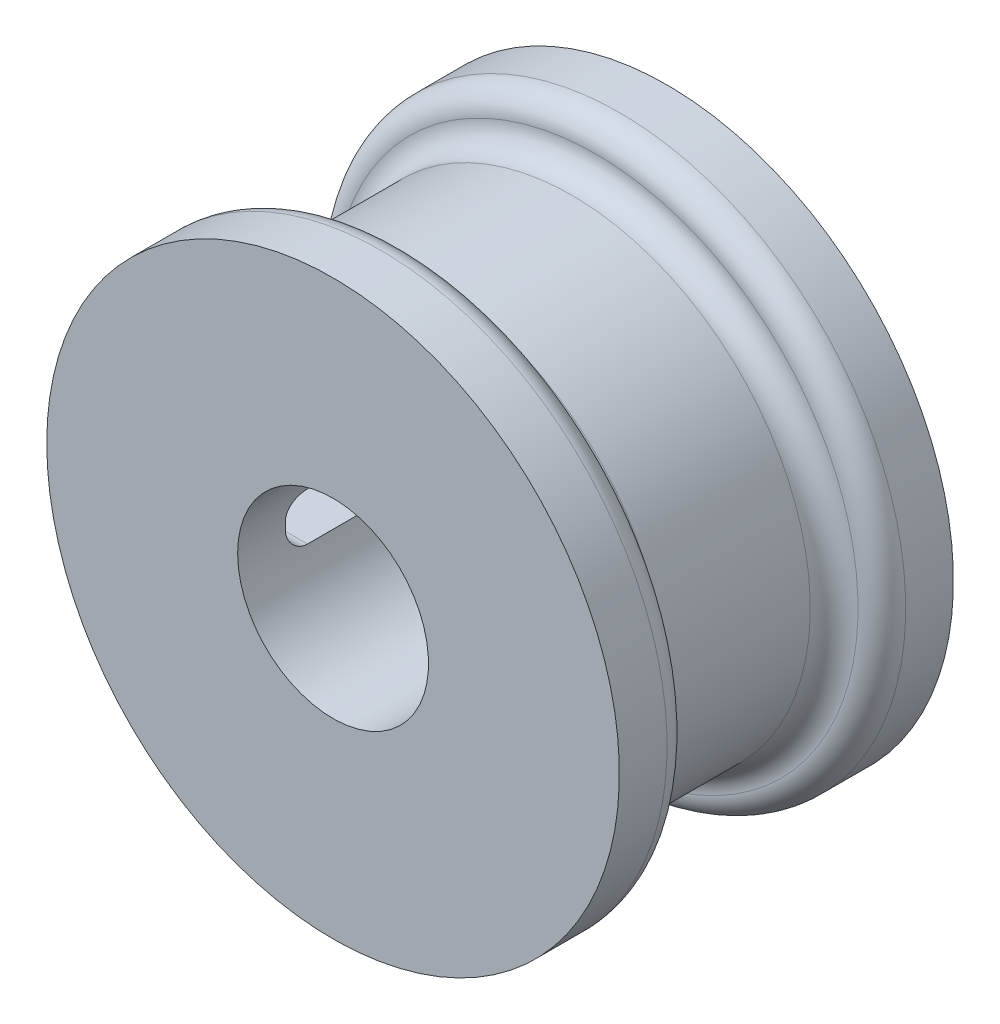
from build123d import *

# Parameters (mm, degrees)
CUT_EXTRUDE1_DEPTH = 12


with BuildPart() as part:
    # Sketch2 → Revolve1 (revolve)
    with BuildSketch(Plane(origin=(0, 0, 0), x_dir=(1, 0, 0), z_dir=(0, 1, 0))):
        with BuildLine():
            Line((2.000000000000001, -2.17e-15), (5.999999999999998, 0))
            Line((5.999999999999998, 0), (6.000000000000001, 0.9999999999999983))
            ThreePointArc((6.000000000000001, 0.9999999999999983), (5.853553390593275, 1.3535533905932722), (5.500000000000001, 1.4999999999999982))
            ThreePointArc((5.500000000000001, 1.4999999999999982), (5.146446609406727, 1.6464466094067245), (5.000000000000001, 1.9999999999999982))
            Line((5.000000000000001, 1.9999999999999982), (5.000000000000001, 4.999999999999998))
            ThreePointArc((5.000000000000001, 4.999999999999998), (5.146446609406727, 5.353553390593272), (5.500000000000001, 5.499999999999998))
            ThreePointArc((5.500000000000001, 5.499999999999998), (5.853553390593275, 5.646446609406724), (6.000000000000001, 5.999999999999998))
            Line((6.000000000000001, 5.999999999999998), (5.999999999999998, 6.999999999999997))
            Line((5.999999999999998, 6.999999999999997), (2.000000000000001, 6.999999999999997))
            Line((2.000000000000001, 6.999999999999997), (2.000000000000001, -2.17e-15))
        make_face()
    revolve(axis=Axis((0, 0, -6.999999999999997), (0, 0, 1)))

    # Sketch4 → Cut-Extrude1 (cut, through all)
    with BuildSketch(Plane(origin=(0, 0, 0), x_dir=(0, 0, -1), z_dir=(1, 0, 0))):
        with BuildLine():
            Line((1.400000000000001, -0.5), (5.599999999999995, -0.5))
            ThreePointArc((5.599999999999995, -0.5), (5.882842712474617, -0.38284271247461926), (5.999999999999998, -0.09999999999999723))
            Line((5.999999999999998, -0.09999999999999723), (5.999999999999998, 0.09999999999999717))
            ThreePointArc((5.999999999999998, 0.09999999999999717), (5.882842712474617, 0.3828427124746192), (5.599999999999995, 0.5))
            Line((5.599999999999995, 0.5), (1.400000000000001, 0.5))
            ThreePointArc((1.400000000000001, 0.5), (1.1171572875253792, 0.38284271247461904), (0.9999999999999983, 0.09999999999999723))
            Line((0.9999999999999983, 0.09999999999999723), (0.9999999999999983, -0.09999999999999717))
            ThreePointArc((0.9999999999999983, -0.09999999999999717), (1.1171572875253792, -0.38284271247461893), (1.400000000000001, -0.5))
        make_face()
    extrude(amount=-CUT_EXTRUDE1_DEPTH, mode=Mode.SUBTRACT)


solid = part.part
